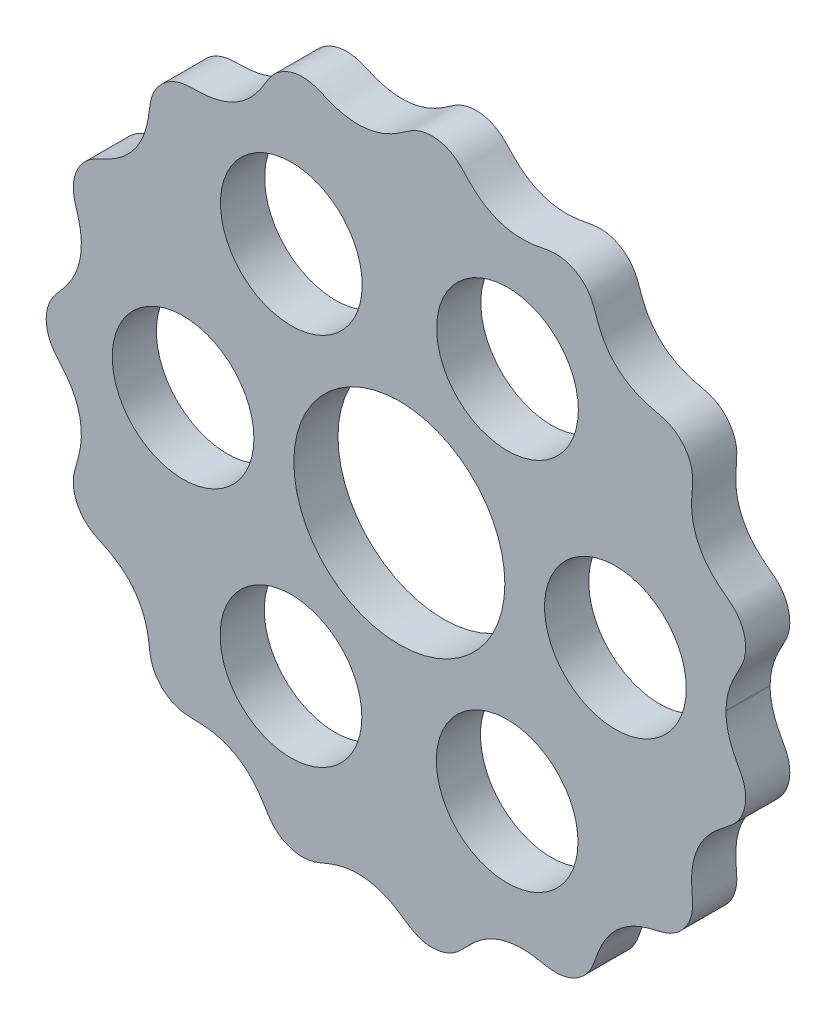
from build123d import *

# Parameters (mm, degrees)
BOSS_EXTRUDE1_DEPTH = 5
SKETCH2_R           = 11.95
SKETCH2_R_2         = 8.025
CUT_EXTRUDE1_DEPTH  = 57.653596622


# Read off the part's stored shape, not the designer's step: Boss-Extrude1
with BuildPart() as part:
    # Boss-Extrude1 outline → Boss-Extrude1 (new body)
    with BuildSketch(Plane.XY):
        with BuildLine():
            Line((36.998722033, -0.001054281), (36.99954865, 0.112257386))
            add(Edge.make_bspline(
                [(36.99954865, 0.112257386), (37.000270367, 0.161831196), (37.002853756, 0.261309148), (37.011083739, 0.475612896), (37.027751866, 0.686060064), (37.057401299, 0.973781963), (37.106377226, 1.31810626), (37.171822023, 1.656164832), (37.253267458, 1.993388321), (37.347124748, 2.325846439), (37.452941361, 2.655441957), (37.593357547, 3.033759794), (37.800770534, 3.51967602), (38.063070944, 4.054128866), (38.380004735, 4.635374121), (38.732518387, 5.273630146), (39.046751238, 6.008512211), (39.236640726, 6.858055977), (39.250091521, 7.787066394), (39.053564794, 8.75531068), (38.626208159, 9.732695543), (38.025700448, 10.517383756), (37.328054136, 11.091682662), (36.60811715, 11.629850376), (35.975000223, 12.138034306), (35.152550193, 12.91020298), (34.390673897, 13.870253643), (33.789981735, 14.95868362), (33.378085782, 16.145067451), (33.169373356, 17.154843178), (33.092097624, 18.112108135), (33.108904916, 19.000648259), (33.173614, 19.815733524), (33.238879281, 20.560019274), (33.227987247, 21.380129686), (33.047104395, 22.255228109), (32.664665017, 23.127768358), (32.06507968, 23.941852005), (31.23982104, 24.668864946), (30.167791626, 25.209669724), (29.000711136, 25.434830102), (27.857662069, 25.733478365), (26.84322374, 26.116856655), (25.973167428, 26.568653448), (25.160139265, 27.123784444), (24.422495656, 27.779104005), (23.770727885, 28.523846991), (23.215457794, 29.345954056), (22.792691619, 30.162245603), (22.47390955, 30.945683354), (22.219346682, 31.675325555), (21.987533976, 32.336511026), (21.659745235, 33.038802347), (21.169269169, 33.733285134), (20.490527161, 34.370384852), (19.62184838, 34.886918222), (18.721124416, 35.182924139), (17.841990931, 35.279542311), (17.032588114, 35.215325385), (16.30577961, 35.076867908), (15.510727511, 34.926325841), (14.638426571, 34.811573208), (13.688649268, 34.778978993), (12.671565392, 34.867723121), (11.447844853, 35.135462468), (10.292384973, 35.604508144), (9.244164008, 36.252478247), (8.244380121, 37.098840325), (7.447178549, 37.929698394), (6.674634431, 38.793502658), (5.68309281, 39.41558352), (4.66819347, 39.747034623), (3.692809843, 39.849081483), (2.630366398, 39.734817039), (1.530382972, 39.330180269), (0.594362483, 38.643900587), (-0.359798631, 37.997102241), (-1.301372389, 37.49269138), (-2.206771749, 37.131336425), (-3.161399566, 36.878076), (-4.150113917, 36.746090347), (-5.159112151, 36.741723073), (-6.170393876, 36.868024154), (-7.091417923, 37.098213056), (-7.919228397, 37.39230107), (-8.664576462, 37.704746935), (-9.345935181, 37.990582819), (-10.123662642, 38.220232855), (-11.002600535, 38.307242073), (-11.9445112, 38.204102119), (-12.901325323, 37.878615217), (-13.697734929, 37.395441616), (-14.321962314, 36.816489383), (-14.788333399, 36.196222631), (-15.15271525, 35.596738144), (-15.55423565, 34.935241327), (-16.030244773, 34.234700168), (-16.61524447, 33.523916779), (-17.33141745, 32.835420988), (-18.125443708, 32.24348686), (-18.984145093, 31.7575464), (-19.894861635, 31.385470152), (-20.838888358, 31.12642101), (-21.909595088, 30.963786363), (-23.088125921, 30.910663697), (-24.274994516, 30.932065517), (-25.434031129, 30.62446242), (-26.389157903, 30.085624441), (-27.141333946, 29.416783184), (-27.69727162, 28.643752428), (-28.058710579, 27.822059835), (-28.241105604, 27.01230335), (-28.332549336, 26.255181748), (-28.441352124, 25.435207729), (-28.613815275, 24.559922927), (-28.892199166, 23.643549075), (-29.306598206, 22.709052047), (-29.95580069, 21.642454051), (-30.768114001, 20.708833865), (-31.711629586, 19.931800273), (-32.675790022, 19.349849993), (-33.40030725, 18.98501049), (-34.214746578, 18.609763984), (-35.229470131, 18.07968265), (-36.114733026, 17.200706168), (-36.720075728, 16.030293846), (-36.984206131, 14.73501705), (-36.921436836, 13.540326839), (-36.536844923, 12.419312831), (-36.222064605, 11.285126273), (-36.044759387, 10.218808333), (-35.997118214, 9.243188269), (-36.067290528, 8.262910288), (-36.261191486, 7.295472475), (-36.577234742, 6.355849135), (-37.0088699, 5.458795345), (-37.599558744, 4.532516269), (-38.243938105, 3.735290386), (-38.885916528, 3.033020611), (-39.436551465, 2.254140701), (-39.796055658, 1.48046551), (-40.011497212, 0.573417452), (-40.026612923, -0.437283008), (-39.83543547, -1.364356277), (-39.483345482, -2.1726004), (-39.027053396, -2.841063846), (-38.546053167, -3.400176958), (-38.019306876, -4.011037517), (-37.4839594, -4.705445769), (-36.9799451, -5.507802007), (-36.546140169, -6.427806197), (-36.236329623, -7.387083398), (-36.053781782, -8.367659532), (-35.997037565, -9.354790726), (-36.059079888, -10.329485057), (-36.246239764, -11.38357784), (-36.566424081, -12.493071312), (-36.931379346, -13.597775621), (-36.980703376, -14.770029814), (-36.710370557, -16.057740558), (-36.09410814, -17.230756), (-35.067609609, -18.228819967), (-33.784970318, -18.798452451), (-32.751396611, -19.29632661), (-31.637911457, -19.983115099), (-30.501762392, -20.94144115), (-29.575814047, -22.135732199), (-28.925964108, -23.50281001), (-28.590028762, -24.66344732), (-28.428347132, -25.52966679), (-28.325131449, -26.334004858), (-28.232745376, -27.069385325), (-28.045129505, -27.860973503), (-27.682554734, -28.669502504), (-27.123409006, -29.436271159), (-26.364707126, -30.103880562), (-25.550537644, -30.553425904), (-24.740620095, -30.806480973), (-23.97308253, -30.902740914), (-23.273939358, -30.919490682), (-22.502855754, -30.935753534), (-21.660848761, -30.995699397), (-20.755458968, -31.143633919), (-19.803336359, -31.415038945), (-18.893624774, -31.802079177), (-18.041061706, -32.298846798), (-17.25961325, -32.899231861), (-16.557986937, -33.586951826), (-15.877270869, -34.433905919), (-15.237275543, -35.42990474), (-14.662795523, -36.472993139), (-13.817758148, -37.329214514), (-12.870992683, -37.89144908), (-11.91204679, -38.211565908), (-10.964987774, -38.307049033), (-10.078357726, -38.210724198), (-9.295914268, -37.96984607), (-8.609229525, -37.678839537), (-7.8557317, -37.365570415), (-7.017669629, -37.074469353), (-6.085831103, -36.850873928), (-5.062752273, -36.735276131), (-3.808276519, -36.757214235), (-2.585154279, -36.989126891), (-1.436131485, -37.415006627), (-0.296689553, -38.037508647), (0.643436405, -38.683822821), (1.575687506, -39.355623169), (2.669397264, -39.742606598), (3.723806861, -39.848834564), (4.694097873, -39.740195807), (5.715557522, -39.401367705), (6.720324277, -38.755118722), (7.656439553, -37.683960891), (8.83657926, -36.512961786), (10.161723139, -35.644794212), (11.538286303, -35.108041682), (12.750288343, -34.857416342), (13.745574669, -34.779578069), (14.670794337, -34.816123496), (15.514541118, -34.928897433), (16.279136012, -35.072817118), (16.971564564, -35.205288227), (17.748142508, -35.278608078), (18.600989485, -35.206427359), (19.496372698, -34.940981685), (20.380385726, -34.451026121), (21.088226956, -33.824538987), (21.612792464, -33.119704651), (21.96521667, -32.393866486), (22.209201019, -31.700415058), (22.47336021, -30.940939076), (22.80406093, -30.132196479), (23.243053928, -29.295611883), (23.817496134, -28.460842401), (24.649676677, -27.531606055), (25.809747588, -26.610264213), (27.225978407, -25.902033944), (28.82566442, -25.471890962), (30.216326183, -25.19491269), (31.272650701, -24.645093521), (32.073667779, -23.929645469), (32.650932336, -23.142109086), (33.084816806, -22.173026821), (33.292673149, -21.027507985), (33.173363035, -19.880870911), (33.085925414, -18.739242734), (33.120199423, -17.436854068), (33.33141262, -16.227060355), (33.747552539, -15.052890892), (34.360355928, -13.958928795), (34.973244187, -13.13577506), (35.6329212, -12.444924412), (36.303323804, -11.868151838), (36.949747372, -11.374502376), (37.542926334, -10.926101731), (38.138564068, -10.36834062), (38.661644623, -9.649469585), (39.051622501, -8.775534009), (39.253528668, -7.771627681), (39.232399083, -6.819885719), (39.03171435, -5.963997917), (38.706407116, -5.225345417), (38.348390806, -4.582262366), (38.030274513, -3.994030786), (37.768638219, -3.452599851), (37.563114133, -2.959998795), (37.424791209, -2.576230778), (37.321329499, -2.242346894), (37.245350457, -1.961010862), (37.19102617, -1.734632017), (37.143162747, -1.506409484), (37.101957025, -1.276429983), (37.067473649, -1.048557704), (37.039794321, -0.812504101), (37.021586593, -0.61210125), (37.010300225, -0.444046604), (37.002482905, -0.262758267), (36.999587895, -0.126805105), (36.998720424, -0.051157403), (36.998722033, -0.001054281)],
                knots=[0.069906552, 0.069906552, 0.069906552, 0.069906552, 0.069906552, 0.070662705, 0.071418858, 0.072175011, 0.072931163, 0.074443469, 0.075955774, 0.076711927, 0.07746808, 0.078980385, 0.08049269, 0.082004996, 0.084395977, 0.086786958, 0.08917794, 0.091568921, 0.094847068, 0.098125216, 0.101274746, 0.104424276, 0.108751929, 0.110915756, 0.113079582, 0.116233921, 0.119388259, 0.125696936, 0.129069551, 0.132442167, 0.135814782, 0.139187398, 0.141638114, 0.144088829, 0.146539545, 0.148990261, 0.152358337, 0.155726414, 0.158934823, 0.162143232, 0.166691212, 0.171239193, 0.174449338, 0.177659484, 0.18086963, 0.184079776, 0.187325474, 0.190571172, 0.19381687, 0.197062568, 0.199360109, 0.20165765, 0.203955191, 0.206252732, 0.209495427, 0.212738122, 0.216072123, 0.219406124, 0.221832132, 0.224258141, 0.226684149, 0.229110158, 0.23244866, 0.235787163, 0.239125665, 0.242464168, 0.248842239, 0.252031274, 0.25522031, 0.259595681, 0.263971051, 0.267155181, 0.270339311, 0.273527927, 0.276716543, 0.281098028, 0.285479514, 0.288672977, 0.291866441, 0.295059905, 0.298253368, 0.301587487, 0.304921605, 0.308255723, 0.311589842, 0.314012663, 0.316435485, 0.318858306, 0.321281127, 0.324610812, 0.327940497, 0.331187646, 0.334434795, 0.336735333, 0.339035871, 0.341336408, 0.343636946, 0.346887177, 0.350137408, 0.35338764, 0.356637871, 0.35984345, 0.363049029, 0.366254608, 0.369460188, 0.374002159, 0.37854413, 0.381748168, 0.384952206, 0.388295162, 0.391638118, 0.394139738, 0.396641357, 0.399142977, 0.401644597, 0.404988572, 0.408332548, 0.411676523, 0.415020498, 0.421320268, 0.424470152, 0.427620037, 0.42978082, 0.431941604, 0.436263171, 0.442553477, 0.44575116, 0.448948842, 0.4534821, 0.458015359, 0.461214295, 0.464413231, 0.467612167, 0.470811103, 0.474067915, 0.477324728, 0.48058154, 0.483838353, 0.488448153, 0.490753054, 0.493057954, 0.496311571, 0.499565188, 0.502888593, 0.506211997, 0.508630191, 0.511048385, 0.513466578, 0.515884772, 0.519212512, 0.522540252, 0.525867992, 0.529195732, 0.532395625, 0.535595519, 0.538795412, 0.541995305, 0.546385703, 0.5507761, 0.553971235, 0.55716637, 0.563521587, 0.567888097, 0.572254606, 0.575437202, 0.578619797, 0.584984988, 0.59167472, 0.595019587, 0.598364453, 0.600795097, 0.603225741, 0.605656385, 0.608087029, 0.611427296, 0.614767562, 0.618003803, 0.621240044, 0.623533226, 0.625826408, 0.628119589, 0.630412771, 0.633651874, 0.636890977, 0.640130079, 0.643369182, 0.646585958, 0.649802734, 0.65301951, 0.656236286, 0.66079302, 0.665349754, 0.668564511, 0.671779268, 0.67514097, 0.678502671, 0.680948815, 0.683394958, 0.685841102, 0.688287245, 0.691653534, 0.695019824, 0.698386113, 0.701752402, 0.708074014, 0.711234819, 0.714395625, 0.718732153, 0.723068681, 0.726224574, 0.729380466, 0.732567413, 0.73575436, 0.740272967, 0.744791574, 0.751166985, 0.757542395, 0.760810298, 0.764078201, 0.767346103, 0.770614006, 0.772926291, 0.775238576, 0.777550861, 0.779863146, 0.783127665, 0.786392183, 0.789704968, 0.793017752, 0.795428146, 0.79783854, 0.800248934, 0.802659328, 0.805976281, 0.809293235, 0.812610189, 0.815927142, 0.82228005, 0.828632958, 0.833136991, 0.837641023, 0.840817225, 0.843993427, 0.847160094, 0.850326761, 0.854678316, 0.859029872, 0.862201581, 0.86537329, 0.871716709, 0.875072299, 0.878427889, 0.881783479, 0.88513907, 0.887577489, 0.890015909, 0.892454329, 0.894892749, 0.898243686, 0.901594623, 0.904905775, 0.908216926, 0.910631245, 0.913045564, 0.915459883, 0.917874201, 0.919402492, 0.920930783, 0.922459074, 0.923223219, 0.923987364, 0.92475151, 0.925515655, 0.9262798, 0.927043946, 0.927808091, 0.928572236, 0.928954309, 0.929336382, 0.930100527, 0.930100527, 0.930100527, 0.930100527, 0.930100527], degree=4))
        make_face()
    extrude(amount=BOSS_EXTRUDE1_DEPTH)

    # Sketch2 → Cut-Extrude1 (cut, through all)
    with BuildSketch(Plane.XY.offset(5)):
        Circle(SKETCH2_R)
        with Locations((24.474360993, -0.001054281)):
            Circle(SKETCH2_R_2)
        with Locations((12.211267462, -21.195945502)):
            Circle(SKETCH2_R_2)
        with Locations((-12.275593531, -21.173240586)):
            Circle(SKETCH2_R_2)
        with Locations((-24.499360993, 0.044355552)):
            Circle(SKETCH2_R_2)
        with Locations((-12.236267462, 21.239246773)):
            Circle(SKETCH2_R_2)
        with Locations((12.250593531, 21.216541856)):
            Circle(SKETCH2_R_2)
    extrude(amount=-CUT_EXTRUDE1_DEPTH, mode=Mode.SUBTRACT)


solid = part.part
